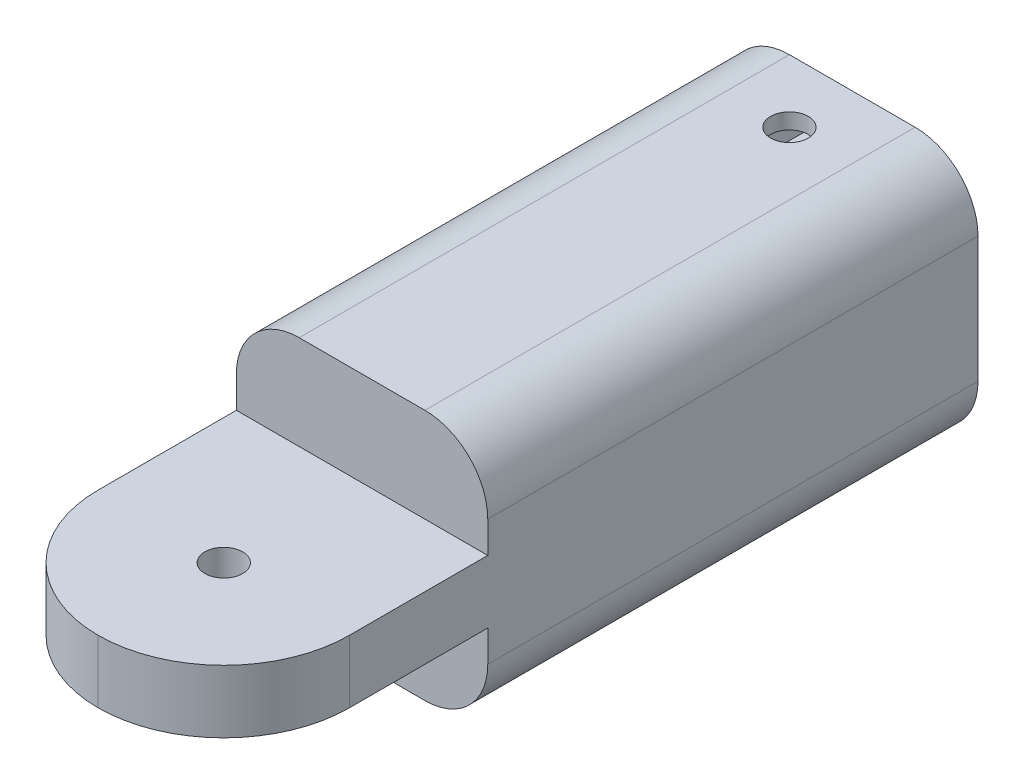
from build123d import *

# Parameters (mm, degrees)
SKETCH1_W           = 20
SKETCH1_H           = 20
SKETCH1_R           = 5.3
BOSS_EXTRUDE1_DEPTH = 35
SKETCH2_W           = 20
SKETCH2_H           = 20
BOSS_EXTRUDE2_DEPTH = 25
CUT_EXTRUDE2_REACH  = 68.332
SKETCH5_R           = 1.5
FILLET2_R           = 10
SKETCH4_W           = 20
SKETCH4_H           = 7.5
CUT_EXTRUDE3_DEPTH  = 21
FILLET3_R           = 5
SKETCH6_W           = 5.65
SKETCH6_H           = 2.5
CUT_EXTRUDE4_DEPTH  = 8
CHAMFER1_SIZE       = 1


with BuildPart() as part:
    # Sketch1 → Boss-Extrude1 (new body)
    with BuildSketch(Plane.XY):
        with Locations((10, 10)):
            Rectangle(SKETCH1_W, SKETCH1_H)
        with Locations((10, 10)):
            Circle(SKETCH1_R, mode=Mode.SUBTRACT)
    extrude(amount=BOSS_EXTRUDE1_DEPTH)

    # Sketch2 → Boss-Extrude2 (add)
    with BuildSketch(Plane.XY.offset(35)):
        with Locations((10, 10)):
            Rectangle(SKETCH2_W, SKETCH2_H)
    extrude(amount=BOSS_EXTRUDE2_DEPTH)

    # Cut-Extrude2: up to this face of the body (flat: up to its plane)
    cut_extrude2_end = Plane(part.part.faces().sort_by_distance((10, 0, 30))[0])
    # Sketch5 → Cut-Extrude2 (cut, up to the picked face)
    with BuildSketch(Plane(origin=(0, 20, 0), x_dir=(1, 0, 0), z_dir=(0, 1, 0)), mode=Mode.PRIVATE) as cut_extrude2_sk1:
        with Locations(Location((10, -5, 0), (0, 0, 270))):
            Circle(SKETCH5_R)
    cut_extrude2_tool1 = split(extrude(cut_extrude2_sk1.sketch, amount=-CUT_EXTRUDE2_REACH, mode=Mode.PRIVATE), bisect_by=cut_extrude2_end, keep=Keep.BOTH, mode=Mode.PRIVATE)
    # Sketch5 → Cut-Extrude2 (cut, up to the picked face)
    with BuildSketch(Plane(origin=(0, 20, 0), x_dir=(1, 0, 0), z_dir=(0, 1, 0)), mode=Mode.PRIVATE) as cut_extrude2_sk2:
        with Locations(Location((10, -50, 0), (0, 0, 270))):
            Circle(SKETCH5_R)
    cut_extrude2_tool2 = split(extrude(cut_extrude2_sk2.sketch, amount=-CUT_EXTRUDE2_REACH, mode=Mode.PRIVATE), bisect_by=cut_extrude2_end, keep=Keep.BOTH, mode=Mode.PRIVATE)
    add(cut_extrude2_tool1.solids().sort_by(Axis((10, 20, 5), (0, -1, 0)))[0], mode=Mode.SUBTRACT)
    add(cut_extrude2_tool2.solids().sort_by(Axis((10, 20, 50), (0, -1, 0)))[0], mode=Mode.SUBTRACT)

    # Fillet2
    fillet2_edges = [part.edges().sort_by_distance(p)[0] for p in [
        (0, 10, 60),
        (20, 10, 60),
    ]]
    fillet(fillet2_edges, radius=FILLET2_R - 0.0001)  # a hair under: the kernel refuses the full size

    # Sketch4 → Cut-Extrude3 (cut)
    with BuildSketch(Plane.XY.offset(60)):
        with Locations((10, 3.75)):
            Rectangle(SKETCH4_W, SKETCH4_H)
        with Locations((10, 16.25)):
            Rectangle(SKETCH4_W, SKETCH4_H)
    extrude(amount=-CUT_EXTRUDE3_DEPTH, mode=Mode.SUBTRACT)

    # Fillet3
    fillet3_edges = [part.edges().sort_by_distance(p)[0] for p in [
        (0, 20, 19.5),
        (20, 20, 19.5),
        (20, 0, 19.5),
        (0, 0, 19.5),
    ]]
    fillet(fillet3_edges, radius=FILLET3_R)

    # Sketch6 → Cut-Extrude4 (cut)
    with BuildSketch(Plane(origin=(0, 0, 0), x_dir=(-1, 0, 0), z_dir=(0, 0, -1))):
        with Locations((-10, 17.5)):
            Rectangle(SKETCH6_W, SKETCH6_H)
        with Locations((-10, 2.5)):
            Rectangle(SKETCH6_W, SKETCH6_H)
    extrude(amount=-CUT_EXTRUDE4_DEPTH, mode=Mode.SUBTRACT)

    # Chamfer1
    chamfer1_edges = [part.edges().sort_by_distance(p)[0] for p in [
        (12.825, 17.5, 8),
        (7.175, 17.5, 8),
        (12.825, 2.5, 8),
        (7.175, 2.5, 8),
    ]]
    chamfer(chamfer1_edges, length=CHAMFER1_SIZE)


solid = part.part
